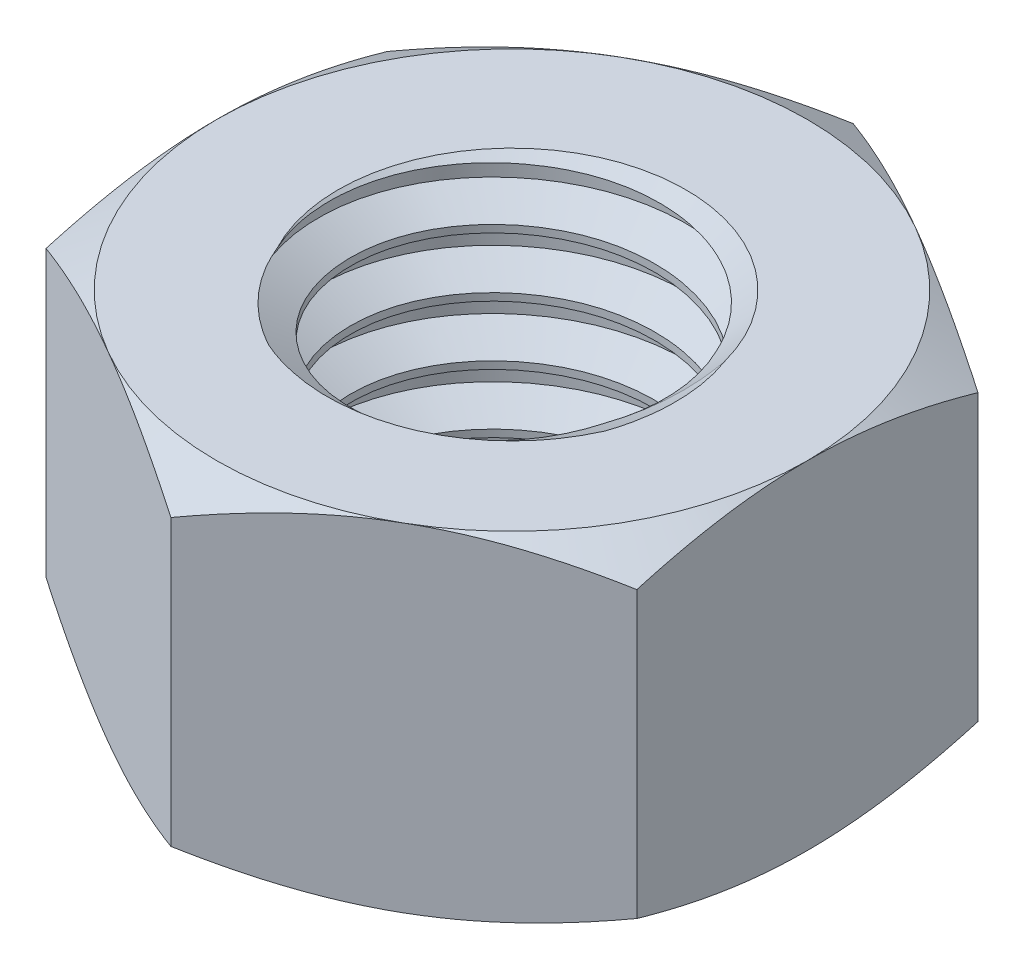
from build123d import *
from OCP.BRepFilletAPI import BRepFilletAPI_MakeChamfer

# Parameters (mm, degrees)
ESTRUSIONE_ESTRUSIONE1_DEPTH = 4
SCHIZZO3_R                   = 1.81
TAGLIO_ESTRUSIONE1_DEPTH     = 7.677075208
SMUSSO2_SIZE                 = 0.25
SMUSSO2_SIZE2                = 0.209774908
FILETTATURA1_PITCH           = 0.7
SCALE1_SCALE                 = 1.25


with BuildPart() as part:
    # Schizzo1 → Estrusione-Estrusione1 (new body)
    with BuildSketch(Plane(origin=(0, 0, 0), x_dir=(1, 0, 0), z_dir=(0, 1, 0))):
        Polygon((0, 4.041451884), (-3.5, 2.020725942), (-3.5, -2.020725942), (0, -4.041451884), (3.5, -2.020725942), (3.5, 2.020725942), align=None)
    extrude(amount=ESTRUSIONE_ESTRUSIONE1_DEPTH)

    # Schizzo3 → Taglio-Estrusione1 (cut, through all)
    with BuildSketch(Plane(origin=(0, 4, 0), x_dir=(1, 0, 0), z_dir=(0, 1, 0))):
        with Locations(Location((0, 0, 0), (0, 0, 270))):
            Circle(SCHIZZO3_R)
    extrude(amount=-TAGLIO_ESTRUSIONE1_DEPTH, mode=Mode.SUBTRACT)

    # Smusso2: one chamfer whose edges measure the first distance from different faces: ONE call of the kernel's chamfer builder (chamfer() names one face for all edges)
    smusso2_edges_1 = [part.edges().sort_by_distance(p)[0] for p in [
        (0, 0, -1.81),
    ]]
    smusso2_side_1 = [part.faces().sort_by_distance(p)[0] for p in [
        (0, 2, -1.81),
    ]]
    smusso2_edges_2 = [part.edges().sort_by_distance(p)[0] for p in [
        (0, 4, -1.81),
    ]]
    smusso2_side_2 = [part.faces().sort_by_distance(p)[0] for p in [
        (-1.696536617, 4, -2.938487617),
    ]]
    smusso2 = BRepFilletAPI_MakeChamfer(part.part.solid().wrapped)
    for e in smusso2_edges_1:
        smusso2.Add(SMUSSO2_SIZE, SMUSSO2_SIZE2, e.wrapped, smusso2_side_1[0].wrapped)  # the first distance lies on this face
    for e in smusso2_edges_2:
        smusso2.Add(SMUSSO2_SIZE, SMUSSO2_SIZE2, e.wrapped, smusso2_side_2[0].wrapped)  # the first distance lies on this face
    add(Compound.cast(smusso2.Shape()), mode=Mode.REPLACE)

    # Filettatura1: the profile of Profilo filettatura1 profile screwed along a right-hand helix of 6.843179 turns, 6 arcs to a turn; built about Z, then put on its axis
    filettatura1_z = Axis((0, 0, 0), (0, 0, 1))
    filettatura1_corners = [(1.8097, 0, 0.612673207), (1.8097, 0, -0.000173205), (2.188886116, 0, 0.218750001), (2.188886116, 0, 0.393750001)]
    with BuildLine(mode=Mode.PRIVATE) as filettatura1_profile:
        Line(filettatura1_corners[0], filettatura1_corners[1])
        Line(filettatura1_corners[1], filettatura1_corners[2])
        Line(filettatura1_corners[2], filettatura1_corners[3])
        Line(filettatura1_corners[3], filettatura1_corners[0])
    filettatura1_cap = Face(filettatura1_profile.wire())
    filettatura1_turn_angles = [0, 30, 60, 90, 120, 150, 180, 210, 240, 270, 300, 330, 360]
    filettatura1_turn_weights = [1, 0.8660254037844387, 1, 0.8660254037844387, 1, 0.8660254037844387, 1, 0.8660254037844387, 1, 0.8660254037844387, 1, 0.8660254037844387, 1]
    filettatura1_turn_rails = [Edge.make_bspline([Vector(p[0], p[1], 0).rotate(filettatura1_z, filettatura1_turn_angles[k]) / filettatura1_turn_weights[k] + Vector(0, 0, p[2] + FILETTATURA1_PITCH * filettatura1_turn_angles[k] / 360) for k in range(13)], [0, 0, 0, 1, 1, 2, 2, 3, 3, 4, 4, 5, 5, 6, 6, 6], 2, filettatura1_turn_weights) for p in filettatura1_corners]
    filettatura1_turn_sides = [Face.make_surface_from_curves(filettatura1_turn_rails[p[0]], filettatura1_turn_rails[p[1]]) for p in [(0, 1), (1, 2), (2, 3), (3, 0)]]
    filettatura1_last_angles = [2160, 2190, 2220, 2250, 2280, 2310, 2340, 2370, 2400, 2430, 2460, 2461.772166567, 2463.544333134]
    filettatura1_last_weights = [1, 0.8660254037844387, 1, 0.8660254037844387, 1, 0.8660254037844387, 1, 0.8660254037844387, 1, 0.8660254037844387, 1, 0.9995217013068117, 1]
    filettatura1_last_rails = [Edge.make_bspline([Vector(p[0], p[1], 0).rotate(filettatura1_z, filettatura1_last_angles[k]) / filettatura1_last_weights[k] + Vector(0, 0, p[2] + FILETTATURA1_PITCH * filettatura1_last_angles[k] / 360) for k in range(13)], [0, 0, 0, 1, 1, 2, 2, 3, 3, 4, 4, 5, 5, 6, 6, 6], 2, filettatura1_last_weights) for p in filettatura1_corners]
    filettatura1_last_sides = [Face.make_surface_from_curves(filettatura1_last_rails[p[0]], filettatura1_last_rails[p[1]]) for p in [(0, 1), (1, 2), (2, 3), (3, 0)]]
    filettatura1 = Plane(origin=(0, 4.790225092, 0), x_dir=(-1, 0, 0), z_dir=(0, -1, 0)) * Solid(Shell([*[p.moved(Location((0, 0, FILETTATURA1_PITCH * i))) for i in range(6) for p in filettatura1_turn_sides], *filettatura1_last_sides, filettatura1_cap, filettatura1_cap.rotate(filettatura1_z, 2463.544333134).moved(Location((0, 0, FILETTATURA1_PITCH * 2463.544333134 / 360)))]))
    add(filettatura1, mode=Mode.SUBTRACT)

    # Schizzo5 → Taglia-Rivoluzione1 (revolve, cut)
    with BuildSketch(Plane(origin=(0, 0, 0), x_dir=(0, 0, -1), z_dir=(1, 0, 0))):
        Polygon((-3.5, 0), (-4.041451884, 0), (-4.041451884, 0.312607391), align=None)
        Polygon((-3.5, 4), (-4.041451884, 4), (-4.041451884, 3.687392609), align=None)
    revolve(axis=Axis((0, 0, 0), (0, 1, 0)), mode=Mode.SUBTRACT)


with BuildPart() as part_1:
    # Scale1: scaled about (0.002282148, 1.999365073, 0.001574095)
    add(part.part.scale(SCALE1_SCALE).moved(Location((-0.000570537, -0.499841268, -0.000393524))))


solid = part_1.part
